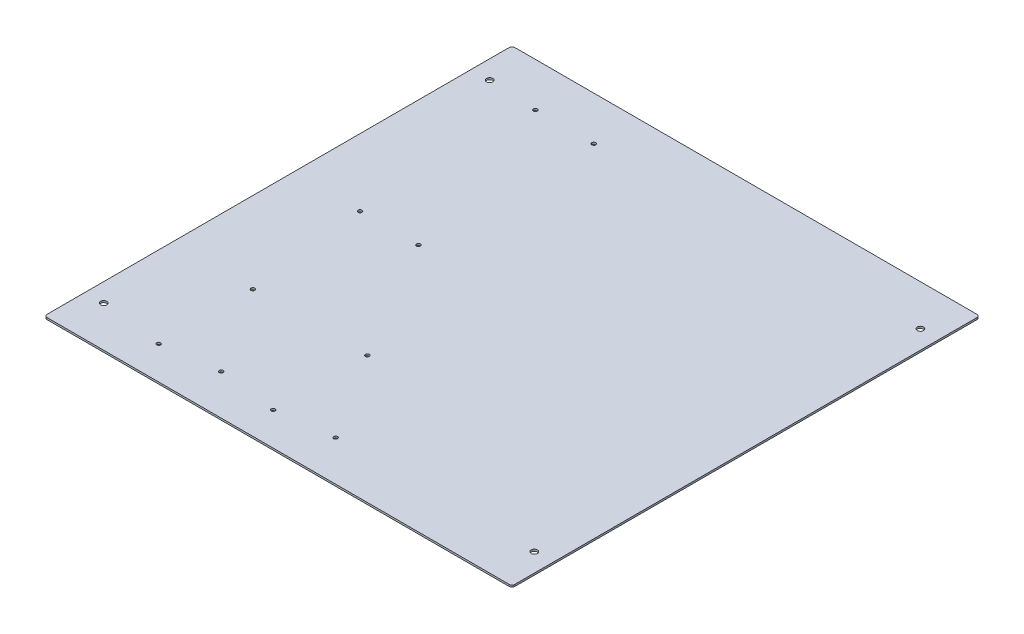
from build123d import *

# Parameters (mm, degrees)
SKETCH1_W           = 400.05
SKETCH1_H           = 400.05
BOSS_EXTRUDE1_DEPTH = 1.5875
CUT_EXTRUDE1_REACH  = 284.883
SKETCH2_R           = 2.665
FILLET1_R           = 2.54
CUT_EXTRUDE2_REACH  = 284.883
SKETCH3_R           = 1.665
CUT_EXTRUDE3_REACH  = 284.883
SKETCH4_R           = 1.665


with BuildPart() as part:
    # Sketch1 → Boss-Extrude1 (new body)
    with BuildSketch(Plane(origin=(0, 0, 0), x_dir=(1, 0, 0), z_dir=(0, 1, 0))):
        Rectangle(SKETCH1_W, SKETCH1_H)
    extrude(amount=BOSS_EXTRUDE1_DEPTH)

    # Sketch2 → Cut-Extrude1 (cut, up to next)
    with BuildSketch(Plane(origin=(0, 1.5875, 0), x_dir=(1, 0, 0), z_dir=(0, 1, 0)), mode=Mode.PRIVATE) as cut_extrude1_sk1:
        with Locations((-184.15, -165.1)):
            Circle(SKETCH2_R)
    cut_extrude1_tool1 = extrude(cut_extrude1_sk1.sketch, amount=-CUT_EXTRUDE1_REACH, mode=Mode.PRIVATE) & part.part
    # Sketch2 → Cut-Extrude1 (cut, up to next)
    with BuildSketch(Plane(origin=(0, 1.5875, 0), x_dir=(1, 0, 0), z_dir=(0, 1, 0)), mode=Mode.PRIVATE) as cut_extrude1_sk2:
        with Locations((184.15, -165.1)):
            Circle(SKETCH2_R)
    cut_extrude1_tool2 = extrude(cut_extrude1_sk2.sketch, amount=-CUT_EXTRUDE1_REACH, mode=Mode.PRIVATE) & part.part
    # Sketch2 → Cut-Extrude1 (cut, up to next)
    with BuildSketch(Plane(origin=(0, 1.5875, 0), x_dir=(1, 0, 0), z_dir=(0, 1, 0)), mode=Mode.PRIVATE) as cut_extrude1_sk3:
        with Locations((184.15, 165.1)):
            Circle(SKETCH2_R)
    cut_extrude1_tool3 = extrude(cut_extrude1_sk3.sketch, amount=-CUT_EXTRUDE1_REACH, mode=Mode.PRIVATE) & part.part
    # Sketch2 → Cut-Extrude1 (cut, up to next)
    with BuildSketch(Plane(origin=(0, 1.5875, 0), x_dir=(1, 0, 0), z_dir=(0, 1, 0)), mode=Mode.PRIVATE) as cut_extrude1_sk4:
        with Locations((-184.15, 165.1)):
            Circle(SKETCH2_R)
    cut_extrude1_tool4 = extrude(cut_extrude1_sk4.sketch, amount=-CUT_EXTRUDE1_REACH, mode=Mode.PRIVATE) & part.part
    add(cut_extrude1_tool1.solids().sort_by_distance((-184.15, 1.5875, 165.1))[0], mode=Mode.SUBTRACT)
    add(cut_extrude1_tool2.solids().sort_by_distance((184.15, 1.5875, 165.1))[0], mode=Mode.SUBTRACT)
    add(cut_extrude1_tool3.solids().sort_by_distance((184.15, 1.5875, -165.1))[0], mode=Mode.SUBTRACT)
    add(cut_extrude1_tool4.solids().sort_by_distance((-184.15, 1.5875, -165.1))[0], mode=Mode.SUBTRACT)

    # Fillet1
    fillet1_edges = [part.edges().sort_by_distance(p)[0] for p in [
        (-200.025, 0.79375, -200.025),
        (200.025, 0.79375, -200.025),
        (200.025, 0.79375, 200.025),
        (-200.025, 0.79375, 200.025),
    ]]
    fillet(fillet1_edges, radius=FILLET1_R)

    # Sketch3 → Cut-Extrude2 (cut, up to next)
    with BuildSketch(Plane.XZ, mode=Mode.PRIVATE) as cut_extrude2_sk1:
        with Locations((-130.439708106, 171.766169153)):
            Circle(SKETCH3_R)
    cut_extrude2_tool1 = extrude(cut_extrude2_sk1.sketch, amount=-CUT_EXTRUDE2_REACH, mode=Mode.PRIVATE) & part.part
    # Sketch3 → Cut-Extrude2 (cut, up to next)
    with BuildSketch(Plane.XZ, mode=Mode.PRIVATE) as cut_extrude2_sk2:
        with Locations((-83.186426808, 165.558058797)):
            Circle(SKETCH3_R)
    cut_extrude2_tool2 = extrude(cut_extrude2_sk2.sketch, amount=-CUT_EXTRUDE2_REACH, mode=Mode.PRIVATE) & part.part
    # Sketch3 → Cut-Extrude2 (cut, up to next)
    with BuildSketch(Plane.XZ, mode=Mode.PRIVATE) as cut_extrude2_sk3:
        with Locations((-130.567422903, 91.046045503)):
            Circle(SKETCH3_R)
    cut_extrude2_tool3 = extrude(cut_extrude2_sk3.sketch, amount=-CUT_EXTRUDE2_REACH, mode=Mode.PRIVATE) & part.part
    # Sketch3 → Cut-Extrude2 (cut, up to next)
    with BuildSketch(Plane.XZ, mode=Mode.PRIVATE) as cut_extrude2_sk4:
        with Locations((-32.50023816, 171.766169153)):
            Circle(SKETCH3_R)
    cut_extrude2_tool4 = extrude(cut_extrude2_sk4.sketch, amount=-CUT_EXTRUDE2_REACH, mode=Mode.PRIVATE) & part.part
    # Sketch3 → Cut-Extrude2 (cut, up to next)
    with BuildSketch(Plane.XZ, mode=Mode.PRIVATE) as cut_extrude2_sk5:
        with Locations((14.753043138, 165.558058797)):
            Circle(SKETCH3_R)
    cut_extrude2_tool5 = extrude(cut_extrude2_sk5.sketch, amount=-CUT_EXTRUDE2_REACH, mode=Mode.PRIVATE) & part.part
    # Sketch3 → Cut-Extrude2 (cut, up to next)
    with BuildSketch(Plane.XZ, mode=Mode.PRIVATE) as cut_extrude2_sk6:
        with Locations((-32.627952956, 91.046045503)):
            Circle(SKETCH3_R)
    cut_extrude2_tool6 = extrude(cut_extrude2_sk6.sketch, amount=-CUT_EXTRUDE2_REACH, mode=Mode.PRIVATE) & part.part
    add(cut_extrude2_tool1.solids().sort_by_distance((-130.439708, 0, 171.766169))[0], mode=Mode.SUBTRACT)
    add(cut_extrude2_tool2.solids().sort_by_distance((-83.186427, 0, 165.558059))[0], mode=Mode.SUBTRACT)
    add(cut_extrude2_tool3.solids().sort_by_distance((-130.567423, 0, 91.046046))[0], mode=Mode.SUBTRACT)
    add(cut_extrude2_tool4.solids().sort_by_distance((-32.500238, 0, 171.766169))[0], mode=Mode.SUBTRACT)
    add(cut_extrude2_tool5.solids().sort_by_distance((14.753043, 0, 165.558059))[0], mode=Mode.SUBTRACT)
    add(cut_extrude2_tool6.solids().sort_by_distance((-32.627953, 0, 91.046046))[0], mode=Mode.SUBTRACT)

    # Sketch4 → Cut-Extrude3 (cut, up to next)
    with BuildSketch(Plane(origin=(0, 1.5875, 0), x_dir=(1, 0, 0), z_dir=(0, 1, 0)), mode=Mode.PRIVATE) as cut_extrude3_sk1:
        with Locations((-142.525, 162.525)):
            Circle(SKETCH4_R)
    cut_extrude3_tool1 = extrude(cut_extrude3_sk1.sketch, amount=-CUT_EXTRUDE3_REACH, mode=Mode.PRIVATE) & part.part
    # Sketch4 → Cut-Extrude3 (cut, up to next)
    with BuildSketch(Plane(origin=(0, 1.5875, 0), x_dir=(1, 0, 0), z_dir=(0, 1, 0)), mode=Mode.PRIVATE) as cut_extrude3_sk2:
        with Locations((-92.525, 162.525)):
            Circle(SKETCH4_R)
    cut_extrude3_tool2 = extrude(cut_extrude3_sk2.sketch, amount=-CUT_EXTRUDE3_REACH, mode=Mode.PRIVATE) & part.part
    # Sketch4 → Cut-Extrude3 (cut, up to next)
    with BuildSketch(Plane(origin=(0, 1.5875, 0), x_dir=(1, 0, 0), z_dir=(0, 1, 0)), mode=Mode.PRIVATE) as cut_extrude3_sk3:
        with Locations((-92.525, 12.525)):
            Circle(SKETCH4_R)
    cut_extrude3_tool3 = extrude(cut_extrude3_sk3.sketch, amount=-CUT_EXTRUDE3_REACH, mode=Mode.PRIVATE) & part.part
    # Sketch4 → Cut-Extrude3 (cut, up to next)
    with BuildSketch(Plane(origin=(0, 1.5875, 0), x_dir=(1, 0, 0), z_dir=(0, 1, 0)), mode=Mode.PRIVATE) as cut_extrude3_sk4:
        with Locations((-142.525, 12.525)):
            Circle(SKETCH4_R)
    cut_extrude3_tool4 = extrude(cut_extrude3_sk4.sketch, amount=-CUT_EXTRUDE3_REACH, mode=Mode.PRIVATE) & part.part
    add(cut_extrude3_tool1.solids().sort_by_distance((-142.525, 1.5875, -162.525))[0], mode=Mode.SUBTRACT)
    add(cut_extrude3_tool2.solids().sort_by_distance((-92.525, 1.5875, -162.525))[0], mode=Mode.SUBTRACT)
    add(cut_extrude3_tool3.solids().sort_by_distance((-92.525, 1.5875, -12.525))[0], mode=Mode.SUBTRACT)
    add(cut_extrude3_tool4.solids().sort_by_distance((-142.525, 1.5875, -12.525))[0], mode=Mode.SUBTRACT)


solid = part.part
